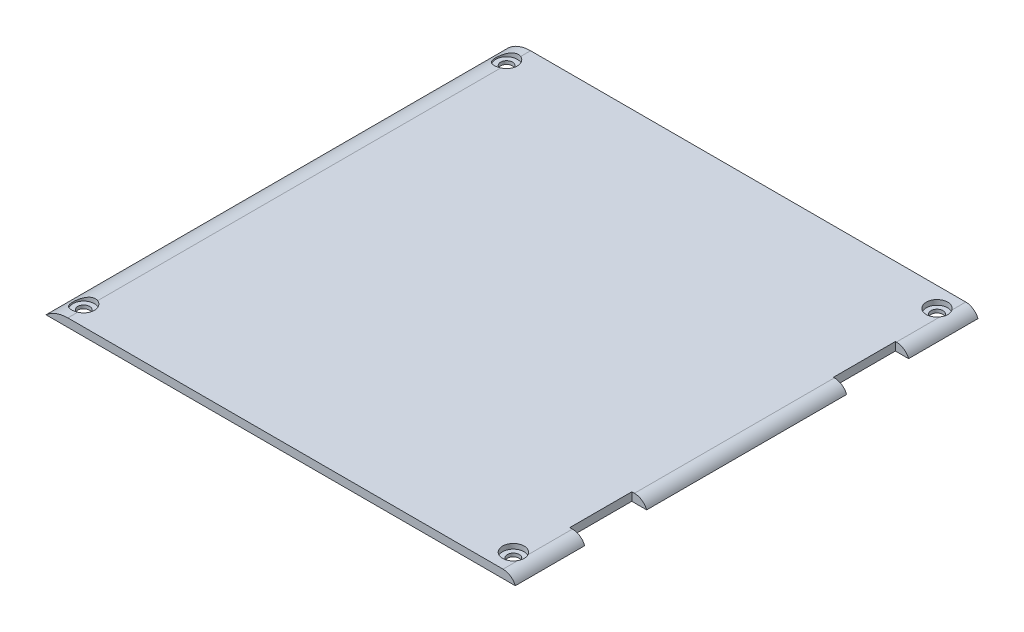
from build123d import *

# Parameters (mm, degrees)
SKETCH1_W                                   = 142
SKETCH1_H                                   = 140
BOSS_EXTRUDE1_DEPTH                         = 2.5
SKETCH6_W                                   = 4
SKETCH6_H                                   = 18.75
CUT_EXTRUDE1_DEPTH                          = 100.735901259
SKETCH7_W                                   = 4.5
SKETCH7_H                                   = 18.75
CUT_EXTRUDE2_DEPTH                          = 100.735901259
CBORE_FOR_M3_CHEESE_HEAD_SCREW1_D           = 3.6
CBORE_FOR_M3_CHEESE_HEAD_SCREW1_CBORE_D     = 6.5
CBORE_FOR_M3_CHEESE_HEAD_SCREW1_CBORE_DEPTH = 1.5
FILLET4_R                                   = 10
FILLET7_R                                   = 4


with BuildPart() as part:
    # Sketch1 → Boss-Extrude1 (new body)
    with BuildSketch(Plane(origin=(0, 0, 0), x_dir=(1, 0, 0), z_dir=(0, 1, 0))):
        Rectangle(SKETCH1_W, SKETCH1_H)
    extrude(amount=-BOSS_EXTRUDE1_DEPTH)

    # Sketch6 → Cut-Extrude1 (cut, through all)
    with BuildSketch(Plane(origin=(0, 0, 0), x_dir=(1, 0, 0), z_dir=(0, 1, 0))):
        with Locations((69, 39.625)):
            Rectangle(SKETCH6_W, SKETCH6_H)
    extrude(amount=-CUT_EXTRUDE1_DEPTH, mode=Mode.SUBTRACT)

    # Sketch7 → Cut-Extrude2 (cut, through all)
    with BuildSketch(Plane(origin=(0, 0, 0), x_dir=(1, 0, 0), z_dir=(0, 1, 0))):
        with Locations((68.75, -39.625)):
            Rectangle(SKETCH7_W, SKETCH7_H)
    extrude(amount=-CUT_EXTRUDE2_DEPTH, mode=Mode.SUBTRACT)

    # CBORE for M3 Cheese Head Screw1 (through all)
    with Locations(Plane(origin=(-65.6357603, 0, -64), x_dir=(0, 0, 1), z_dir=(0, 1, 0))):
        with Locations((0, 0), (0, 130.23152632), (128, 130.05051113), (128, 0.0399943)):
            CounterBoreHole(CBORE_FOR_M3_CHEESE_HEAD_SCREW1_D / 2, CBORE_FOR_M3_CHEESE_HEAD_SCREW1_CBORE_D / 2, CBORE_FOR_M3_CHEESE_HEAD_SCREW1_CBORE_DEPTH)

    # Fillet4
    # the kernel refuses this fillet: 10 mm, written as the material it takes off along each edge
    with BuildSketch(Plane(origin=(-71, 0, 86.535945694), x_dir=(0, -1, 0), z_dir=(0, 0, -1))) as fillet4_piece_1:
        with BuildLine():
            CenterArc((10, -6.614378278), FILLET4_R, 138.590377891, 41.409622109)
            Line((0, -6.614378278), (-0.2, -6.614378278))
            Line((-0.2, -6.614378278), (-0.2, 0))
            Line((-0.2, 0), (0, 0.2))
            ThreePointArc((0, 0.2), (1.25, 0.2), (2.35, 0.132287566))
            Line((2.35, 0.132287566), (2.5, 0))
        make_face()
    extrude(amount=173.071891388, mode=Mode.SUBTRACT)

    # Fillet7
    # the kernel refuses this fillet: 4 mm, written as the material it takes off along each edge
    with BuildSketch(Plane(origin=(71, 0, 39.729751891), x_dir=(-1, 0, 0), z_dir=(0, 0, 1)), Plane(origin=(71, 0, -79.270248109), x_dir=(-1, 0, 0), z_dir=(0, 0, 1))) as fillet7_piece_1:
        with BuildLine():
            CenterArc((3.708099244, 4), FILLET7_R, 202.024312837, 67.975687163)
            Line((0, 2.5), (-0.074161985, 2.47))
            ThreePointArc((-0.074161985, 2.47), (-0.08, 1.25), (-0.08, 0))
            Line((-0.08, 0), (0, -0.08))
            Line((0, -0.08), (3.708099244, -0.08))
            Line((3.708099244, -0.08), (3.708099244, 0))
        make_face()
    extrude(amount=39.540496218, mode=Mode.SUBTRACT)
    with BuildSketch(Plane(origin=(71, 0, -39.520248109), x_dir=(-1, 0, 0), z_dir=(0, 0, 1))) as fillet7_piece_2:
        with BuildLine():
            CenterArc((3.708099244, 4), FILLET7_R, 202.024312837, 67.975687163)
            Line((0, 2.5), (-0.074161985, 2.47))
            ThreePointArc((-0.074161985, 2.47), (-0.08, 1.25), (-0.08, 0))
            Line((-0.08, 0), (0, -0.08))
            Line((0, -0.08), (3.708099244, -0.08))
            Line((3.708099244, -0.08), (3.708099244, 0))
        make_face()
    extrude(amount=79.040496218, mode=Mode.SUBTRACT)


solid = part.part
